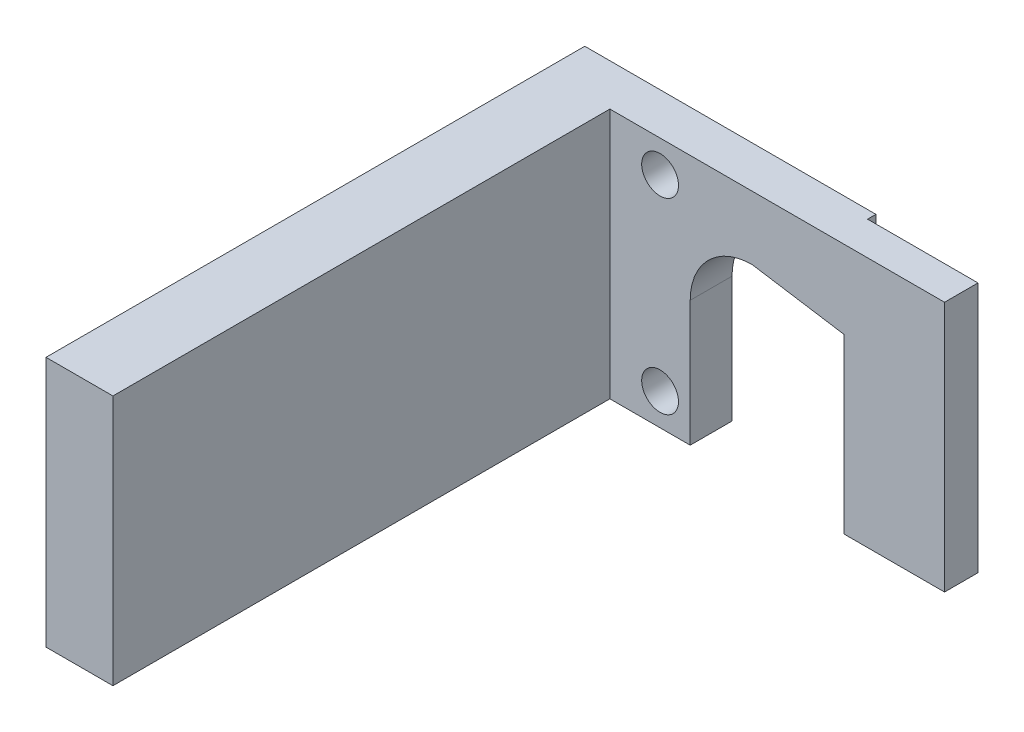
from build123d import *

# Parameters (mm, degrees)
SKETCH1_R           = 2.794
BOSS_EXTRUDE1_DEPTH = 6.35
SKETCH4_W           = 16.764
SKETCH4_H           = 1.27
CUT_EXTRUDE3_DEPTH  = 50.203281395
SKETCH5_W           = 10.16
SKETCH5_H           = 38.1
BOSS_EXTRUDE2_DEPTH = 75.438


with BuildPart() as part:
    # Sketch1 → Boss-Extrude1 (new body)
    with BuildSketch(Plane.XY):
        with BuildLine():
            Line((-8.128, -19.05), (-8.128, 0))
            ThreePointArc((-8.128, 0), (-5.37538953, 6.64538953), (1.27, 9.398))
            Line((1.27, 9.398), (15.24, 7.185369369))
            Line((15.24, 7.185369369), (15.24, -19.05))
            Line((15.24, -19.05), (30.48, -19.05))
            Line((30.48, -19.05), (30.48, 9.398))
            Line((30.48, 9.398), (30.48, 19.05))
            Line((30.48, 19.05), (-30.48, 19.05))
            Line((-30.48, 19.05), (-30.48, -19.05))
            Line((-30.48, -19.05), (-8.128, -19.05))
        make_face()
        with Locations((-12.7, -14.224)):
            Circle(SKETCH1_R, mode=Mode.SUBTRACT)
        with Locations((-12.7, 14.224)):
            Circle(SKETCH1_R, mode=Mode.SUBTRACT)
    extrude(amount=-BOSS_EXTRUDE1_DEPTH)

    # Sketch4 → Cut-Extrude3 (cut, through all)
    with BuildSketch(Plane(origin=(0, 19.05, 0), x_dir=(1, 0, 0), z_dir=(0, 1, 0))):
        with Locations((22.098, 5.715)):
            Rectangle(SKETCH4_W, SKETCH4_H)
    extrude(amount=-CUT_EXTRUDE3_DEPTH, mode=Mode.SUBTRACT)

    # Sketch5 → Boss-Extrude2 (add)
    with BuildSketch(Plane.XY):
        with Locations((-25.4, 0)):
            Rectangle(SKETCH5_W, SKETCH5_H)
    extrude(amount=BOSS_EXTRUDE2_DEPTH)


solid = part.part
